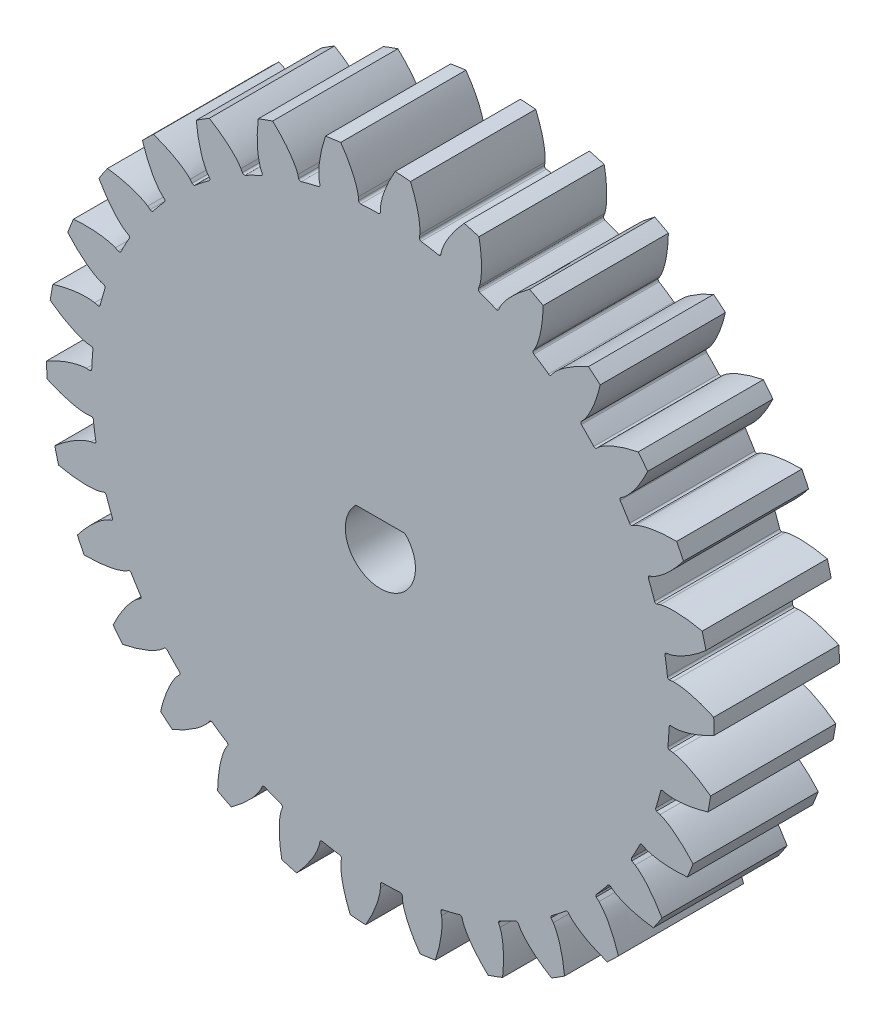
from build123d import *

# Parameters (mm, degrees)
CROQUIS2_R              = 2.1
SALIENTE_EXTRUIR1_DEPTH = 7.5
MATRIZC6_COUNT          = 30
SALIENTE_EXTRUIR2_START = -7.5
SALIENTE_EXTRUIR2_DEPTH = 7.5


with BuildPart() as part:
    # Croquis2 → Saliente-Extruir1 (new body)
    with BuildSketch(Plane.XY):
        with BuildLine():
            Line((0, 17.391052591), (0, 17.61923664))
            add(Edge.make_bspline(
                [(0, 17.61923664), (0.002968389, 17.708678911), (0.030865619, 17.908423079), (0.110728878, 18.25740541), (0.25502818, 18.704841344), (0.488882061, 19.262091692), (0.716792081, 19.695707807), (0.862564894, 19.944247124), (0.88412324, 19.980448596)],
                knots=[0, 0, 0, 0, 0.049384323, 0.111112812, 0.197532517, 0.308643471, 0.44444569, 0.467706461, 0.467706461, 0.467706461, 0.467706461], degree=3))
            ThreePointArc((0.88412324, 19.980448596), (1.344285858, 19.954771247), (1.80373463, 19.918497468))
            add(Edge.make_bspline(
                [(2.363172784, 17.460037633), (2.372227624, 17.549069881), (2.371373063, 17.75075096), (2.33903852, 18.10729168), (2.256055196, 18.57003888), (2.099055278, 19.153619735), (1.931363125, 19.613886239), (1.820242679, 19.879731591), (1.80373463, 19.918497468)],
                knots=[0, 0, 0, 0, 0.049384323, 0.111112812, 0.197532517, 0.308643471, 0.44444569, 0.467706461, 0.467706461, 0.467706461, 0.467706461], degree=3))
            Line((2.363172784, 17.460037633), (2.332489759, 17.275351458))
            ThreePointArc((2.332489759, 17.275351458), (2.354972763, 17.180980546), (2.438186458, 17.131112365))
            ThreePointArc((2.438186458, 17.131112365), (-1.163059321, -17.264618649), (-0.118452851, 17.303344561))
            ThreePointArc((-0.118452851, 17.303344561), (-0.044924166, 17.327882859), (0, 17.391052591))
        make_face()
        Circle(CROQUIS2_R, mode=Mode.SUBTRACT)
    saliente_extruir1 = extrude(amount=SALIENTE_EXTRUIR1_DEPTH)

    # MatrizC6: Saliente-Extruir1 ×30 about axis
    matrizc6_axis = Axis((0, 0, 7.5), (0, 0, -1))
    for i in range(1, MATRIZC6_COUNT):
        add(saliente_extruir1.rotate(matrizc6_axis, i * 360 / MATRIZC6_COUNT))

    # Croquis6 → Saliente-Extruir2 (add)
    with BuildSketch(Plane.XY.offset(7.5).offset(SALIENTE_EXTRUIR2_START)):
        with BuildLine():
            Line((0, 1.5), (1.469693846, 1.5))
            ThreePointArc((1.469693846, 1.5), (0, 2.1), (-1.469693846, 1.5))
            Line((-1.469693846, 1.5), (0, 1.5))
        make_face()
    extrude(amount=SALIENTE_EXTRUIR2_DEPTH)


solid = part.part
